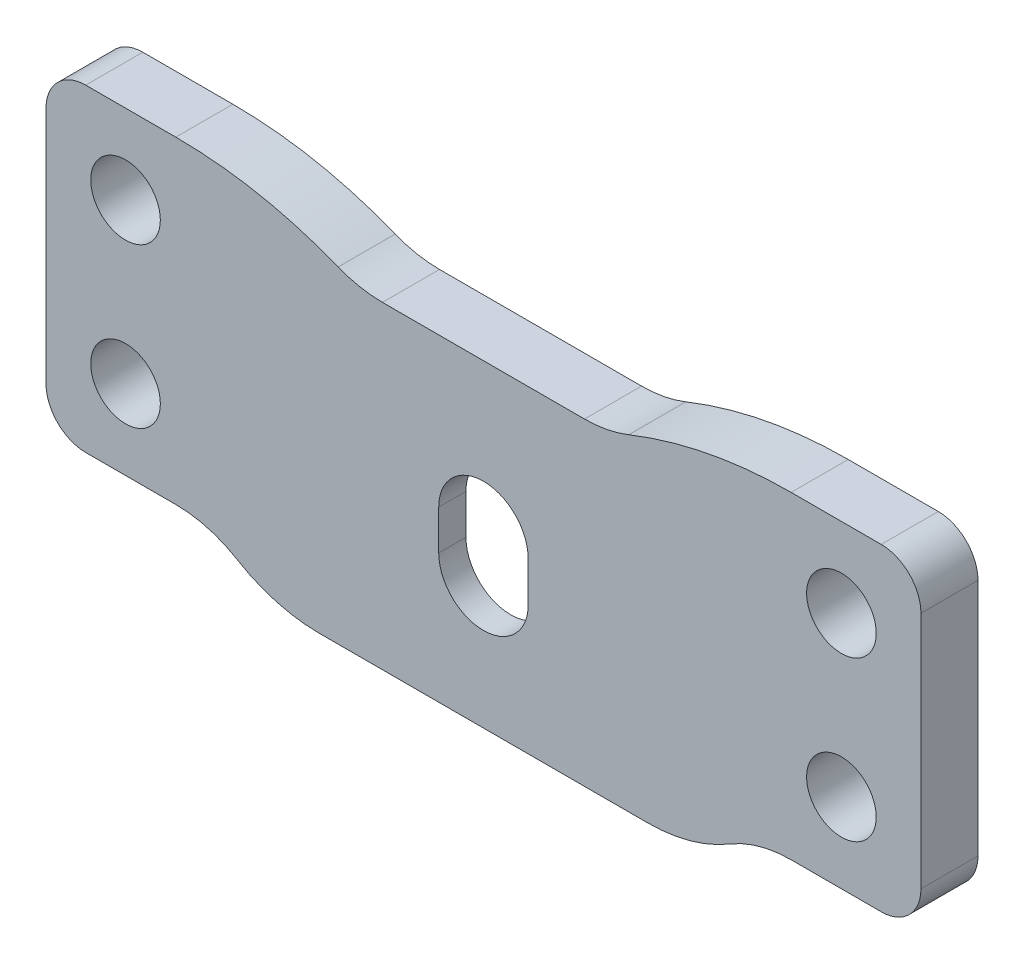
from build123d import *

# Parameters (mm, degrees)
SKETCH1_W                       = 69.85
SKETCH1_H                       = 25.4
BASE_FLANGE1_DEPTH              = 4.55422
F_7_32_0_21875_DIAMETER_HOLE1_D = 5.55625
BREAK_CORNER1_DEPTH             = 4.55422
SKETCH4_W                       = 34.925
SKETCH4_H                       = 3.175
TAB1_DEPTH                      = 4.55422
FILLET1_R                       = 9.525
CUT_EXTRUDE1_REACH              = 40.633
SKETCH7_R                       = 9.525
CUT_EXTRUDE3_DEPTH              = 2.38125
F_9_32_0_28125_DIAMETER_HOLE1_D = 7.14375
FILLET3_R                       = 12.7
CUT_EXTRUDE4_START              = -2.17297
CUT_EXTRUDE4_DEPTH              = 2.17297


# Read off the part's stored shape, not the designer's step: Break-Corner1
# Sheet-metal steps are written as plain solids
with BuildPart() as part:
    # Sketch1 → Base-Flange1 (new body)
    with BuildSketch(Plane.XY):
        Rectangle(SKETCH1_W, SKETCH1_H)
    extrude(amount=BASE_FLANGE1_DEPTH)

    # 7/32 (0.21875) Diameter Hole1 (through all)
    with Locations(Plane.XY.offset(4.55422)):
        with Locations((-28.575, 6.35), (-28.575, -6.35), (28.575, 6.35), (28.575, -6.35)):
            Hole(F_7_32_0_21875_DIAMETER_HOLE1_D / 2)

    # Break-Corner1 outline → Break-Corner1 (cut)
    with BuildSketch(Plane.XY):
        with BuildLine():
            Line((34.925, -12.7), (34.925, -9.525))
            ThreePointArc((34.925, -9.525), (33.99506403, -11.77006403), (31.75, -12.7))
            Line((31.75, -12.7), (34.925, -12.7))
        make_face()
        with BuildLine():
            ThreePointArc((31.75, 12.7), (33.99506403, 11.77006403), (34.925, 9.525))
            Line((34.925, 9.525), (34.925, 12.7))
            Line((34.925, 12.7), (31.75, 12.7))
        make_face()
        with BuildLine():
            Line((-34.925, -12.7), (-31.75, -12.7))
            ThreePointArc((-31.75, -12.7), (-33.99506403, -11.77006403), (-34.925, -9.525))
            Line((-34.925, -9.525), (-34.925, -12.7))
        make_face()
        with BuildLine():
            ThreePointArc((-34.925, 9.525), (-33.99506403, 11.77006403), (-31.75, 12.7))
            Line((-31.75, 12.7), (-34.925, 12.7))
            Line((-34.925, 12.7), (-34.925, 9.525))
        make_face()
    extrude(amount=BREAK_CORNER1_DEPTH, mode=Mode.SUBTRACT)

    # Sketch4 → Tab1 (add)
    with BuildSketch(Plane(origin=(0, 0, 0), x_dir=(-1, 0, 0), z_dir=(0, 0, -1))):
        with Locations((0, -14.2875)):
            Rectangle(SKETCH4_W, SKETCH4_H)
    extrude(amount=-TAB1_DEPTH)

    # Fillet1
    # the kernel refuses this fillet: 9.525 mm, written as the material it adds along each edge
    with BuildSketch(Plane(origin=(-17.4625, -12.7, 0), x_dir=(-1, 0, 0), z_dir=(0, 0, 1))) as fillet1_piece_1:
        with BuildLine():
            CenterArc((7.099515829, 9.525), FILLET1_R, 221.810314896, 48.189685104)
            Line((0, 3.175), (-0.141990317, 3.048))
            ThreePointArc((-0.141990317, 3.048), (-0.1905, 1.5875), (-0.1905, 0))
            Line((-0.1905, 0), (0, -0.1905))
            Line((0, -0.1905), (7.099515829, -0.1905))
            Line((7.099515829, -0.1905), (7.099515829, 0))
        make_face()
    extrude(amount=4.55422)
    with BuildSketch(Plane(origin=(17.4625, -12.7, 0), x_dir=(1, 0, 0), z_dir=(0, 0, 1))) as fillet1_piece_2:
        with BuildLine():
            CenterArc((7.099515829, -9.525), FILLET1_R, 90, 48.189685104)
            Line((0, -3.175), (-0.141990317, -3.048))
            ThreePointArc((-0.141990317, -3.048), (-0.1905, -1.5875), (-0.1905, 0))
            Line((-0.1905, 0), (0, 0.1905))
            Line((0, 0.1905), (7.099515829, 0.1905))
            Line((7.099515829, 0.1905), (7.099515829, 0))
        make_face()
    extrude(amount=4.55422)

    # Sketch5 → Cut-Extrude1 (cut, up to next)
    with BuildSketch(Plane(origin=(0, 0, 0), x_dir=(-1, 0, 0), z_dir=(0, 0, -1)), mode=Mode.PRIVATE) as cut_extrude1_sk1:
        with BuildLine():
            Line((-8.064231886, 9.525), (8.064231886, 9.525))
            ThreePointArc((8.064231886, 9.525), (9.864287689, 9.69663568), (11.599471303, 10.205357143))
            ThreePointArc((11.599471303, 10.205357143), (17.961811219, 12.070669174), (24.562015829, 12.7))
            Line((24.562015829, 12.7), (-24.562015829, 12.7))
            ThreePointArc((-24.562015829, 12.7), (-17.961811219, 12.070669174), (-11.599471303, 10.205357143))
            ThreePointArc((-11.599471303, 10.205357143), (-9.864287689, 9.69663568), (-8.064231886, 9.525))
        make_face()
    cut_extrude1_tool1 = extrude(cut_extrude1_sk1.sketch, amount=-CUT_EXTRUDE1_REACH, mode=Mode.PRIVATE) & part.part
    add(cut_extrude1_tool1.solids().sort_by_distance((0, 11.328032, 0))[0], mode=Mode.SUBTRACT)

    # Sketch7 → Cut-Extrude3 (cut)
    with BuildSketch(Plane(origin=(0, 0, 0), x_dir=(-1, 0, 0), z_dir=(0, 0, -1))):
        with Locations((0, -3.175)):
            Circle(SKETCH7_R)
    extrude(amount=-CUT_EXTRUDE3_DEPTH, mode=Mode.SUBTRACT)

    # 9/32 (0.28125) Diameter Hole1 (through all)
    with Locations(Plane(origin=(0, 0, 2.38125), x_dir=(-1, 0, 0), z_dir=(0, 0, -1))):
        with Locations((0, -3.175)):
            Hole(F_9_32_0_28125_DIAMETER_HOLE1_D / 2)

    # Fillet3
    fillet3_edges = [part.edges().sort_by_distance(p)[0] for p in [
        (17.4625, -15.875, 2.27711),
        (-17.4625, -15.875, 2.27711),
    ]]
    fillet(fillet3_edges, radius=FILLET3_R)

    # Sketch10 → Cut-Extrude4 (cut)
    with BuildSketch(Plane.XY.offset(4.55422).offset(CUT_EXTRUDE4_START)):
        with BuildLine():
            Line((3.571875, -2.38125), (3.571875, -5.55625))
            ThreePointArc((3.571875, -5.55625), (0, -9.128125), (-3.571875, -5.55625))
            Line((-3.571875, -5.55625), (-3.571875, -2.38125))
            ThreePointArc((-3.571875, -2.38125), (0, 1.190625), (3.571875, -2.38125))
        make_face()
    extrude(amount=CUT_EXTRUDE4_DEPTH, mode=Mode.SUBTRACT)


solid = part.part
